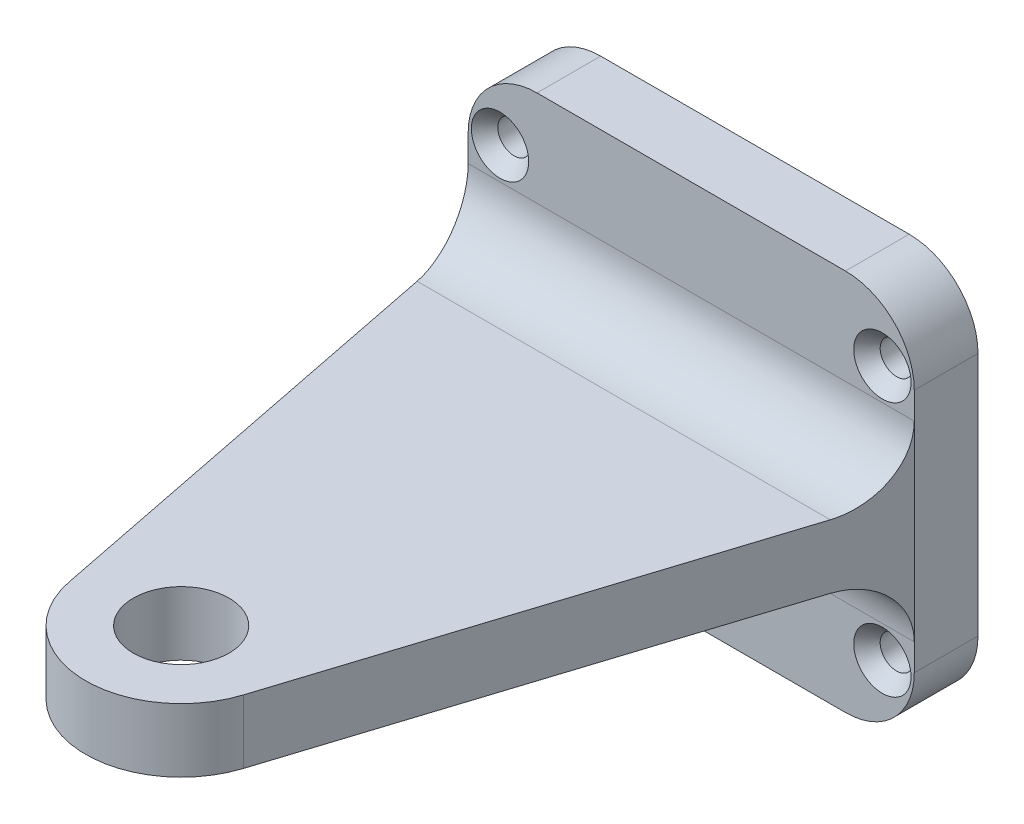
from build123d import *

# Parameters (mm, degrees)
SKETCH1_W                                      = 44.45
SKETCH1_H                                      = 38.1
BOSS_EXTRUDE1_DEPTH                            = 6.35
CSK_FOR_4_FLAT_HEAD_MACHINE_SCREW1_D           = 3.2639
CSK_FOR_4_FLAT_HEAD_MACHINE_SCREW1_CSINK_D     = 5.715
CSK_FOR_4_FLAT_HEAD_MACHINE_SCREW1_CSINK_ANGLE = 82
SKETCH4_R                                      = 4.7625
BOSS_EXTRUDE2_DEPTH                            = 3.175
FILLET2_R                                      = 6.858
FILLET3_R                                      = 6.35


with BuildPart() as part:
    # Sketch1 → Boss-Extrude1 (new body)
    with BuildSketch(Plane.XY):
        Rectangle(SKETCH1_W, SKETCH1_H)
    extrude(amount=BOSS_EXTRUDE1_DEPTH)

    # CSK for #4 Flat Head Machine Screw1 (through all)
    with Locations(Plane.XY.offset(6.35)):
        with Locations((-19.05, 12.7), (19.05, -12.7), (-19.05, -12.7), (19.05, 12.7)):
            CounterSinkHole(CSK_FOR_4_FLAT_HEAD_MACHINE_SCREW1_D / 2, CSK_FOR_4_FLAT_HEAD_MACHINE_SCREW1_CSINK_D / 2, counter_sink_angle=CSK_FOR_4_FLAT_HEAD_MACHINE_SCREW1_CSINK_ANGLE)

    # Sketch4 → Boss-Extrude2 (add, symmetric)
    with BuildSketch(Plane(origin=(0, 0, 0), x_dir=(1, 0, 0), z_dir=(0, 1, 0))):
        with BuildLine():
            Line((-12.341914895, -56.026561414), (-22.225, -6.35))
            Line((-22.225, -6.35), (22.225, -6.35))
            Line((22.225, -6.35), (6.07586016, -57.058395803))
            ThreePointArc((6.07586016, -57.058395803), (-3.532791524, -63.678087179), (-12.341914895, -56.026561414))
        make_face()
        with Locations(Location((-2.99999997, -54.168, 0), (0, 0, 270))):
            Circle(SKETCH4_R, mode=Mode.SUBTRACT)
    extrude(amount=BOSS_EXTRUDE2_DEPTH, both=True)

    # Fillet2
    fillet2_edges = [part.edges().sort_by_distance(p)[0] for p in [
        (22.225, -19.05, 3.175),
        (-22.225, -19.05, 3.175),
        (-22.225, 19.05, 3.175),
        (22.225, 19.05, 3.175),
    ]]
    fillet(fillet2_edges, radius=FILLET2_R)

    # Fillet3
    # the kernel refuses this fillet: 6.35 mm, written as the material it adds along each edge
    with BuildSketch(Plane(origin=(-22.225, 3.175, 6.35), x_dir=(0, 1, 0), z_dir=(1, 0, 0))) as fillet3_piece_1_section:
        with BuildLine():
            CenterArc((FILLET3_R, FILLET3_R), FILLET3_R, 180, 90)
            Line((0, FILLET3_R), (0, 0))
            Line((0, 0), (FILLET3_R, 0))
        make_face()
    fillet3_piece_1 = extrude(amount=44.45, mode=Mode.PRIVATE)
    fillet3_piece_1 = split(fillet3_piece_1, bisect_by=Plane(origin=(-21.111154549, 4.625615872, 11.948657846), z_dir=(0.980778469831864, 0, -0.19512455794765435)), keep=Keep.TOP, mode=Mode.PRIVATE)
    fillet3_piece_1 = split(fillet3_piece_1, bisect_by=Plane(origin=(19.761324723, 4.625615872, 14.085955123), z_dir=(-0.9528462078877957, 0, -0.30345362761688605)), keep=Keep.TOP, mode=Mode.PRIVATE)
    add(fillet3_piece_1)
    with BuildSketch(Plane(origin=(-22.225, -3.175, 6.35), x_dir=(0, -1, 0), z_dir=(1, 0, 0))) as fillet3_piece_2_section:
        with BuildLine():
            CenterArc((FILLET3_R, -FILLET3_R), FILLET3_R, 90, 90)
            Line((0, -FILLET3_R), (0, 0))
            Line((0, 0), (FILLET3_R, 0))
        make_face()
    fillet3_piece_2 = extrude(amount=44.45, mode=Mode.PRIVATE)
    fillet3_piece_2 = split(fillet3_piece_2, bisect_by=Plane(origin=(-21.111154549, -4.625615872, 11.948657846), z_dir=(0.980778469831864, 0, -0.19512455794765435)), keep=Keep.TOP, mode=Mode.PRIVATE)
    fillet3_piece_2 = split(fillet3_piece_2, bisect_by=Plane(origin=(19.761324723, -4.625615872, 14.085955123), z_dir=(-0.9528462078877957, 0, -0.30345362761688605)), keep=Keep.TOP, mode=Mode.PRIVATE)
    add(fillet3_piece_2)


solid = part.part
